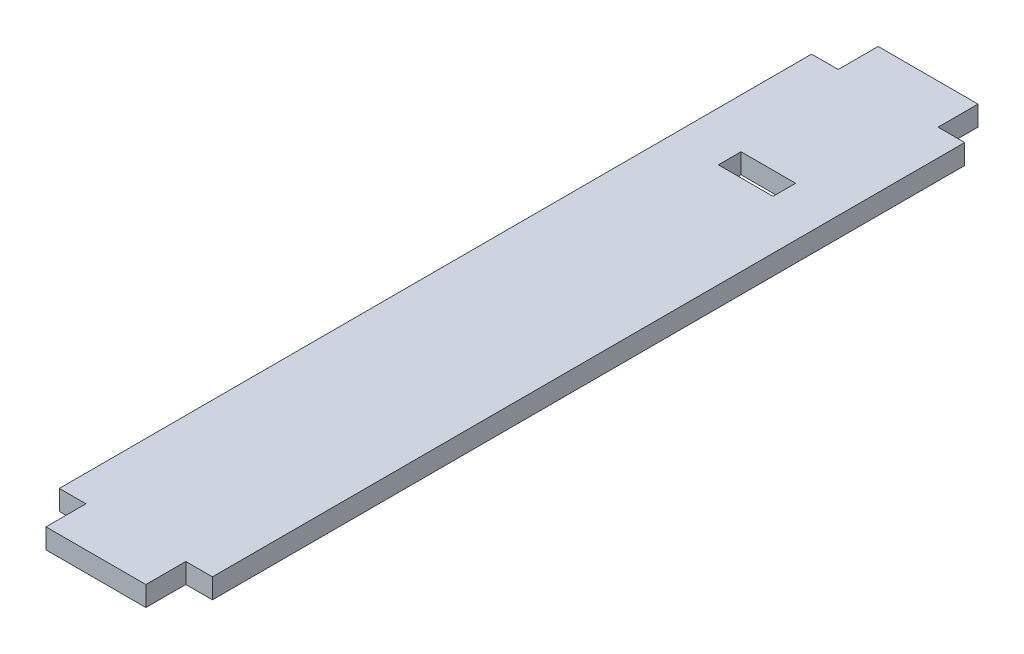
from build123d import *

# Parameters (mm, degrees)
SKETCH1_W           = 4.1
SKETCH1_H           = 1.7
BOSS_EXTRUDE1_DEPTH = 1.5


with BuildPart() as part:
    # Sketch1 → Boss-Extrude1 (new body)
    with BuildSketch(Plane(origin=(0, 0, 0), x_dir=(1, 0, 0), z_dir=(0, 1, 0))):
        Polygon((3.75, 28.25), (5.75, 28.25), (5.75, -12.4), (5.75, -14.1), (5.75, -28.25), (3.75, -28.25), (3.75, -31.25), (-3.75, -31.25), (-3.75, -28.25), (-5.75, -28.25), (-5.75, -16.6), (-5.75, -14.9), (-5.75, 28.25), (-3.75, 28.25), (-3.75, 31.25), (3.75, 31.25), align=None)
        with Locations((0, 18.4)):
            Rectangle(SKETCH1_W, SKETCH1_H, mode=Mode.SUBTRACT)
    extrude(amount=BOSS_EXTRUDE1_DEPTH)


solid = part.part
